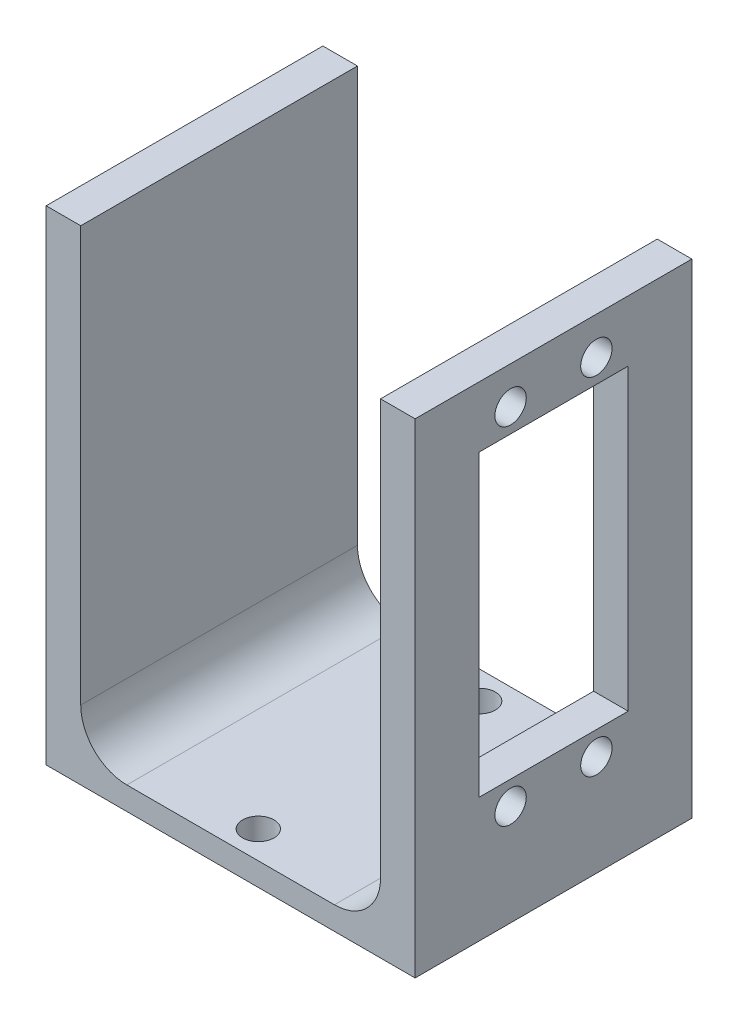
from build123d import *

# Parameters (mm, degrees)
SKETCH1_W           = 50.8
SKETCH1_H           = 38.1
BOSS_EXTRUDE1_DEPTH = 3.175
SKETCH2_W           = 4.7625
SKETCH2_H           = 38.1
BOSS_EXTRUDE2_DEPTH = 63.5
FILLET1_R           = 6.35
CUT_EXTRUDE1_REACH  = 94.075
SKETCH3_R           = 2.159
SKETCH3_W           = 20.574
SKETCH3_H           = 41.148
CUT_EXTRUDE2_REACH  = 91.803
SKETCH4_R           = 2.159


with BuildPart() as part:
    # Sketch1 → Boss-Extrude1 (new body)
    with BuildSketch(Plane(origin=(0, 0, 0), x_dir=(1, 0, 0), z_dir=(0, 1, 0))):
        with Locations((25.4, 19.05)):
            Rectangle(SKETCH1_W, SKETCH1_H)
    extrude(amount=BOSS_EXTRUDE1_DEPTH)

    # Sketch2 → Boss-Extrude2 (add)
    with BuildSketch(Plane(origin=(0, 3.175, 0), x_dir=(1, 0, 0), z_dir=(0, 1, 0))):
        with Locations((48.41875, 19.05)):
            Rectangle(SKETCH2_W, SKETCH2_H)
        with Locations((2.38125, 19.05)):
            Rectangle(SKETCH2_W, SKETCH2_H)
    extrude(amount=BOSS_EXTRUDE2_DEPTH)

    # Fillet1
    fillet1_edges = [part.edges().sort_by_distance(p)[0] for p in [
        (4.7625, 3.175, -19.05),
        (46.0375, 3.175, -19.05),
    ]]
    fillet(fillet1_edges, radius=FILLET1_R)

    # Sketch3 → Cut-Extrude1 (cut, up to next)
    with BuildSketch(Plane(origin=(50.8, 0, 0), x_dir=(0, 0, -1), z_dir=(1, 0, 0)), mode=Mode.PRIVATE) as cut_extrude1_sk1:
        with Locations((24.9555, 61.5315)):
            Circle(SKETCH3_R)
    cut_extrude1_tool1 = extrude(cut_extrude1_sk1.sketch, amount=-CUT_EXTRUDE1_REACH, mode=Mode.PRIVATE) & part.part
    # Sketch3 → Cut-Extrude1 (cut, up to next)
    with BuildSketch(Plane(origin=(50.8, 0, 0), x_dir=(0, 0, -1), z_dir=(1, 0, 0)), mode=Mode.PRIVATE) as cut_extrude1_sk2:
        with Locations((13.1445, 61.5315)):
            Circle(SKETCH3_R)
    cut_extrude1_tool2 = extrude(cut_extrude1_sk2.sketch, amount=-CUT_EXTRUDE1_REACH, mode=Mode.PRIVATE) & part.part
    # Sketch3 → Cut-Extrude1 (cut, up to next)
    with BuildSketch(Plane(origin=(50.8, 0, 0), x_dir=(0, 0, -1), z_dir=(1, 0, 0)), mode=Mode.PRIVATE) as cut_extrude1_sk3:
        with Locations((13.1445, 13.9065)):
            Circle(SKETCH3_R)
    cut_extrude1_tool3 = extrude(cut_extrude1_sk3.sketch, amount=-CUT_EXTRUDE1_REACH, mode=Mode.PRIVATE) & part.part
    # Sketch3 → Cut-Extrude1 (cut, up to next)
    with BuildSketch(Plane(origin=(50.8, 0, 0), x_dir=(0, 0, -1), z_dir=(1, 0, 0)), mode=Mode.PRIVATE) as cut_extrude1_sk4:
        with Locations((24.9555, 13.9065)):
            Circle(SKETCH3_R)
    cut_extrude1_tool4 = extrude(cut_extrude1_sk4.sketch, amount=-CUT_EXTRUDE1_REACH, mode=Mode.PRIVATE) & part.part
    # Sketch3 → Cut-Extrude1 (cut, up to next)
    with BuildSketch(Plane(origin=(50.8, 0, 0), x_dir=(0, 0, -1), z_dir=(1, 0, 0)), mode=Mode.PRIVATE) as cut_extrude1_sk5:
        with Locations((19.05, 37.719)):
            Rectangle(SKETCH3_W, SKETCH3_H)
    cut_extrude1_tool5 = extrude(cut_extrude1_sk5.sketch, amount=-CUT_EXTRUDE1_REACH, mode=Mode.PRIVATE) & part.part
    add(cut_extrude1_tool1.solids().sort_by_distance((50.8, 61.5315, -24.9555))[0], mode=Mode.SUBTRACT)
    add(cut_extrude1_tool2.solids().sort_by_distance((50.8, 61.5315, -13.1445))[0], mode=Mode.SUBTRACT)
    add(cut_extrude1_tool3.solids().sort_by_distance((50.8, 13.9065, -13.1445))[0], mode=Mode.SUBTRACT)
    add(cut_extrude1_tool4.solids().sort_by_distance((50.8, 13.9065, -24.9555))[0], mode=Mode.SUBTRACT)
    add(cut_extrude1_tool5.solids().sort_by_distance((50.8, 37.719, -19.05))[0], mode=Mode.SUBTRACT)

    # Sketch4 → Cut-Extrude2 (cut, up to next)
    with BuildSketch(Plane(origin=(0, 3.175, 0), x_dir=(1, 0, 0), z_dir=(0, 1, 0)), mode=Mode.PRIVATE) as cut_extrude2_sk1:
        with Locations((25.4, 34.29)):
            Circle(SKETCH4_R)
    cut_extrude2_tool1 = extrude(cut_extrude2_sk1.sketch, amount=-CUT_EXTRUDE2_REACH, mode=Mode.PRIVATE) & part.part
    # Sketch4 → Cut-Extrude2 (cut, up to next)
    with BuildSketch(Plane(origin=(0, 3.175, 0), x_dir=(1, 0, 0), z_dir=(0, 1, 0)), mode=Mode.PRIVATE) as cut_extrude2_sk2:
        with Locations((25.4, 3.81)):
            Circle(SKETCH4_R)
    cut_extrude2_tool2 = extrude(cut_extrude2_sk2.sketch, amount=-CUT_EXTRUDE2_REACH, mode=Mode.PRIVATE) & part.part
    add(cut_extrude2_tool1.solids().sort_by_distance((25.4, 3.175, -34.29))[0], mode=Mode.SUBTRACT)
    add(cut_extrude2_tool2.solids().sort_by_distance((25.4, 3.175, -3.81))[0], mode=Mode.SUBTRACT)


solid = part.part
